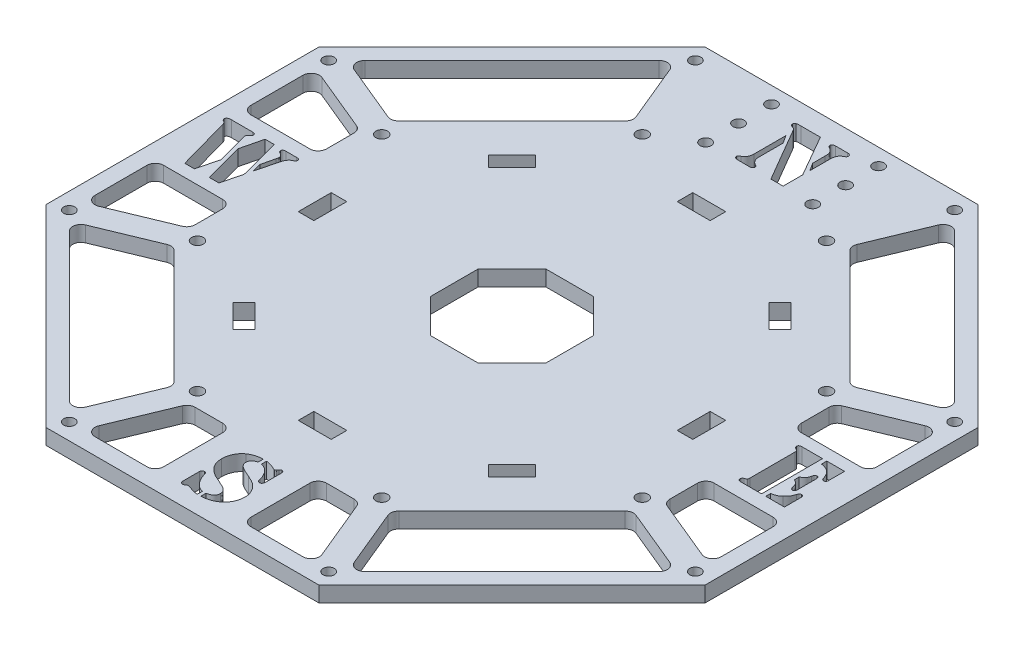
from build123d import *

# Parameters (mm, degrees)
BASE_DEPTH                   = 5.999988
SUPPORT_CUTOUTS_REACH        = 181.705
SKETCH4_W                    = 12.7
SKETCH4_H                    = 5.999988
SUPPORT_CUTOUT_PATTERN_COUNT = 8
F_8_CLEARANCE_HOLE1_D        = 4.4958
MOTOR_WIRE_HOLES_DEPTH       = 180.705313934
MOUNT_CLEARANCE_HOLES_D      = 4.3053
MOUNT_CLEARANCE_HOLES_DEPTH  = 6.35
F_8_CLEARANCE_HOLE2_D        = 4.3053
LIGHTENNING_1_DEPTH          = 180.705313934
DIRECTIONS_DEPTH             = 180.705313934
LIGHTENNING_2_DEPTH          = 180.705314078
LIGHTENNING_2_CIRC_PAT_COUNT = 3
LIGHTENNING_2_CIRC_PAT_ANGLE = 180


with BuildPart() as part:
    # Base sketch → Base (new body)
    with BuildSketch(Plane(origin=(0, 0, 0), x_dir=(1, 0, 0), z_dir=(0, 1, 0))):
        Polygon((-127, 52.605122421), (-127, -52.605122421), (-52.605122421, -127), (52.605122421, -127), (127, -52.605122421), (127, 52.605122421), (52.605122421, 127), (-52.605122421, 127), align=None)
    extrude(amount=BASE_DEPTH)

    # Sketch4 → Support cutouts (cut, up to next)
    with BuildSketch(Plane(origin=(0, 5.999988, 0), x_dir=(1, 0, 0), z_dir=(0, 1, 0)), mode=Mode.PRIVATE) as support_cutouts_sk1:
        with Locations((0, 73.025)):
            Rectangle(SKETCH4_W, SKETCH4_H)
    support_cutouts_tool1 = extrude(support_cutouts_sk1.sketch, amount=-SUPPORT_CUTOUTS_REACH, mode=Mode.PRIVATE) & part.part
    support_cutouts = support_cutouts_tool1.solids().sort_by_distance((0, 5.999988, -73.025))[0]
    add(support_cutouts, mode=Mode.SUBTRACT)

    # Support cutout pattern: Support cutouts ×8 about axis
    support_cutout_pattern_axis = Axis((0, -0.29972, 0), (0, 1, 0))
    for i in range(1, SUPPORT_CUTOUT_PATTERN_COUNT):
        add(support_cutouts.rotate(support_cutout_pattern_axis, i * 360 / SUPPORT_CUTOUT_PATTERN_COUNT), mode=Mode.SUBTRACT)

    # #8 Clearance Hole1 (through all)
    with Locations(Plane(origin=(0, 5.999988, 0), x_dir=(1, 0, 0), z_dir=(0, 1, 0))):
        with Locations((-85.725, 35.508457634), (-35.508457634, 85.725), (35.508457634, 85.725), (85.725, 35.508457634), (85.725, -35.508457634), (35.508457634, -85.725), (-35.508457634, -85.725), (-85.725, -35.508457634)):
            Hole(F_8_CLEARANCE_HOLE1_D / 2)

    # Sketch29 → Motor wire holes (cut, through all)
    with BuildSketch(Plane(origin=(0, 5.999988, 0), x_dir=(1, 0, 0), z_dir=(0, 1, 0))):
        Polygon((-22.225, -9.205896424), (-9.205896424, -22.225), (9.205896424, -22.225), (22.225, -9.205896424), (22.225, 9.205896424), (9.205896424, 22.225), (-9.205896424, 22.225), (-22.225, 9.205896424), align=None)
    extrude(amount=-MOTOR_WIRE_HOLES_DEPTH, mode=Mode.SUBTRACT)

    # mount clearance holes
    with Locations(Plane(origin=(0, 5.999988, 0), x_dir=(1, 0, 0), z_dir=(0, 1, 0))):
        with Locations((-120.65, 49.9748663), (-49.9748663, 120.65), (49.9748663, 120.65), (120.65, 49.9748663), (120.65, -49.9748663), (49.9748663, -120.65), (-49.9748663, -120.65), (-120.65, -49.9748663)):
            Hole(MOUNT_CLEARANCE_HOLES_D / 2, depth=MOUNT_CLEARANCE_HOLES_DEPTH)

    # #8 Clearance Hole2 (through all)
    with Locations(Plane(origin=(0, 5.999988, 0), x_dir=(1, 0, 0), z_dir=(0, 1, 0))):
        with Locations((20.6375, 95.25), (20.6375, 107.95), (20.6375, 120.65), (-20.6375, 120.65), (-20.6375, 107.95), (-20.6375, 95.25)):
            Hole(F_8_CLEARANCE_HOLE2_D / 2)

    # Sketch36 → Lightenning 1 (cut, through all)
    with BuildSketch(Plane(origin=(0, 5.999988, 0), x_dir=(1, 0, 0), z_dir=(0, 1, 0))):
        with BuildLine():
            Line((-112.614920409, 51.801520213), (-90.389920409, 42.595623789))
            ThreePointArc((-90.389920409, 42.595623789), (-88.555488739, 42.41494804), (-86.929836481, 43.283877275))
            Line((-86.929836481, 43.283877275), (-43.283877275, 86.929836481))
            ThreePointArc((-43.283877275, 86.929836481), (-42.41494804, 88.555488739), (-42.595623789, 90.389920409))
            Line((-42.595623789, 90.389920409), (-51.801520213, 112.614920409))
            ThreePointArc((-51.801520213, 112.614920409), (-54.115425956, 114.513893776), (-56.979901759, 113.644964541))
            Line((-56.979901759, 113.644964541), (-113.644964541, 56.979901759))
            ThreePointArc((-113.644964541, 56.979901759), (-114.513893776, 54.115425956), (-112.614920409, 51.801520213))
        make_face()
        with BuildLine():
            Line((56.979901759, 113.644964541), (113.644964541, 56.979901759))
            ThreePointArc((113.644964541, 56.979901759), (114.513893776, 54.115425956), (112.614920409, 51.801520213))
            Line((112.614920409, 51.801520213), (90.389920409, 42.595623789))
            ThreePointArc((90.389920409, 42.595623789), (88.555488739, 42.41494804), (86.929836481, 43.283877275))
            Line((86.929836481, 43.283877275), (43.283877275, 86.929836481))
            ThreePointArc((43.283877275, 86.929836481), (42.41494804, 88.555488739), (42.595623789, 90.389920409))
            Line((42.595623789, 90.389920409), (51.801520213, 112.614920409))
            ThreePointArc((51.801520213, 112.614920409), (54.115425956, 114.513893776), (56.979901759, 113.644964541))
        make_face()
        with BuildLine():
            Line((113.644964541, -56.979901759), (56.979901759, -113.644964541))
            ThreePointArc((56.979901759, -113.644964541), (54.115425956, -114.513893776), (51.801520213, -112.614920409))
            Line((51.801520213, -112.614920409), (42.595623789, -90.389920409))
            ThreePointArc((42.595623789, -90.389920409), (42.41494804, -88.555488739), (43.283877275, -86.929836481))
            Line((43.283877275, -86.929836481), (86.929836481, -43.283877275))
            ThreePointArc((86.929836481, -43.283877275), (88.555488739, -42.41494804), (90.389920409, -42.595623789))
            Line((90.389920409, -42.595623789), (112.614920409, -51.801520213))
            ThreePointArc((112.614920409, -51.801520213), (114.513893776, -54.115425956), (113.644964541, -56.979901759))
        make_face()
        with BuildLine():
            Line((-56.979901759, -113.644964541), (-113.644964541, -56.979901759))
            ThreePointArc((-113.644964541, -56.979901759), (-114.513893776, -54.115425956), (-112.614920409, -51.801520213))
            Line((-112.614920409, -51.801520213), (-90.389920409, -42.595623789))
            ThreePointArc((-90.389920409, -42.595623789), (-88.555488739, -42.41494804), (-86.929836481, -43.283877275))
            Line((-86.929836481, -43.283877275), (-43.283877275, -86.929836481))
            ThreePointArc((-43.283877275, -86.929836481), (-42.41494804, -88.555488739), (-42.595623789, -90.389920409))
            Line((-42.595623789, -90.389920409), (-51.801520213, -112.614920409))
            ThreePointArc((-51.801520213, -112.614920409), (-54.115425956, -114.513893776), (-56.979901759, -113.644964541))
        make_face()
    extrude(amount=-LIGHTENNING_1_DEPTH, mode=Mode.SUBTRACT)

    # Sketch37 → Directions (cut, through all)
    with BuildSketch(Plane(origin=(0, 5.999988, 0), x_dir=(1, 0, 0), z_dir=(0, 1, 0))):
        with BuildLine():
            Line((-0.263655027, 119.115560665), (8.895510373, 103.159733252))
            Line((8.895510373, 103.159733252), (8.895510373, 95.602783972))
            Line((8.895510373, 95.602783972), (4.196016594, 95.602783972))
            Line((4.196016594, 95.602783972), (-7.565474351, 115.758050452))
            add(Edge.make_bspline(
                [(-7.565474351, 115.758050452), (-7.626545799, 115.858484028), (-7.740071239, 116.045179551), (-7.898822848, 116.301319094), (-8.049204258, 116.502903942), (-8.222803652, 116.707787914), (-8.466187591, 116.913139143), (-8.696438169, 117.002669141), (-8.815611133, 117.049008026)],
                knots=[0, 0, 0, 0, 1.148206832, 2.134396517, 2.941784819, 3.601293645, 4.758478929, 6, 6, 6, 6], degree=3))
            Line((-8.815611133, 117.049008026), (-9.473846418, 117.288830184))
            add(Edge.make_bspline(
                [(-9.473846418, 117.288830184), (-9.55527066, 117.324691169), (-9.717709786, 117.396232848), (-9.904505623, 117.592550574), (-10.019149579, 117.836024562), (-10.036623424, 118.012257311), (-10.045337518, 118.100143443)],
                knots=[0, 0, 0, 0, 1.002473422, 1.999906911, 3.00256651, 4, 4, 4, 4], degree=3))
            add(Edge.make_bspline(
                [(-10.045337518, 118.100143443), (-10.037149376, 118.195015854), (-10.020718931, 118.385388219), (-9.897734175, 118.647272373), (-9.71184523, 118.871275333), (-9.539105479, 118.952710769), (-9.453436021, 118.993098287)],
                knots=[0, 0, 0, 0, 0.998849935, 2.004306838, 3.010245474, 4, 4, 4, 4], degree=3))
            add(Edge.make_bspline(
                [(-9.453436021, 118.993098287), (-9.382409116, 119.013998559), (-9.199550463, 119.067806278), (-8.849403273, 119.086590792), (-8.374085078, 119.118367463), (-8.012973394, 119.116569356), (-7.810399108, 119.115560665)],
                knots=[0, 0, 0, 0, 0.536148819, 1.380314255, 2.53042427, 4, 4, 4, 4], degree=3))
            Line((-7.810399108, 119.115560665), (-0.263655027, 119.115560665))
        make_face()
        with BuildLine():
            Line((-7.432806774, 112.977133937), (-5.473408717, 109.961497864))
            Line((-5.473408717, 109.961497864), (-5.473408717, 100.776819469))
            add(Edge.make_bspline(
                [(-5.473408717, 100.776819469), (-5.469055935, 100.586021928), (-5.460700363, 100.21976823), (-5.382728119, 99.6981249), (-5.262710119, 99.227406629), (-5.089068936, 98.805729823), (-4.85213913, 98.431592131), (-4.564343169, 98.090725132), (-4.214003136, 97.787147282), (-3.946837055, 97.621522578), (-3.809961407, 97.536669035)],
                knots=[0, 0, 0, 0, 1.190721145, 2.285700438, 3.285246989, 4.21825195, 5.120024924, 6.039327733, 6.995500152, 8, 8, 8, 8], degree=3))
            Line((-3.809961407, 97.536669035), (-3.299701496, 97.245820885))
            add(Edge.make_bspline(
                [(-3.299701496, 97.245820885), (-3.231857884, 97.201860435), (-3.100479182, 97.116731315), (-2.959354433, 96.929548908), (-2.872470899, 96.712152954), (-2.86483304, 96.556123983), (-2.860877973, 96.47532842)],
                knots=[0, 0, 0, 0, 1.033525086, 2.00141443, 2.965084209, 4, 4, 4, 4], degree=3))
            add(Edge.make_bspline(
                [(-2.860877973, 96.47532842), (-2.864956803, 96.411995733), (-2.872848076, 96.28946659), (-2.93060722, 96.112330477), (-3.036684603, 95.957436924), (-3.129500678, 95.871499071), (-3.177239118, 95.827298333)],
                knots=[0, 0, 0, 0, 1.017932389, 1.969384057, 2.955585702, 4, 4, 4, 4], degree=3))
            add(Edge.make_bspline(
                [(-3.177239118, 95.827298333), (-3.232072148, 95.792158738), (-3.358904473, 95.710878595), (-3.60964788, 95.649789644), (-3.924156844, 95.610370207), (-4.156704558, 95.605474468), (-4.284503124, 95.602783972)],
                knots=[0, 0, 0, 0, 0.677978509, 1.568207904, 2.663588058, 4, 4, 4, 4], degree=3))
            Line((-4.284503124, 95.602783972), (-8.397198006, 95.602783972))
            add(Edge.make_bspline(
                [(-8.397198006, 95.602783972), (-8.526583167, 95.6057372), (-8.7673749, 95.611233293), (-9.104615381, 95.650410986), (-9.390388373, 95.718713479), (-9.626206962, 95.817067881), (-9.817639262, 95.936422178), (-9.951644061, 96.097510927), (-10.032074991, 96.288123463), (-10.040832926, 96.425222666), (-10.045337518, 96.495738816)],
                knots=[0, 0, 0, 0, 1.481402756, 2.756958638, 3.881237287, 4.832623133, 5.67532584, 6.435925958, 7.195527913, 8, 8, 8, 8], degree=3))
            add(Edge.make_bspline(
                [(-10.045337518, 96.495738816), (-10.040152027, 96.59001324), (-10.030404998, 96.767218379), (-9.903412197, 96.961501544), (-9.760252857, 97.097334013), (-9.59197636, 97.203111948), (-9.385634761, 97.33974442), (-9.224767325, 97.424262529), (-9.137074877, 97.470335246)],
                knots=[0, 0, 0, 0, 1.181703852, 2.22121744, 2.84898449, 3.689607338, 4.740553118, 6, 6, 6, 6], degree=3))
            add(Edge.make_bspline(
                [(-9.137074877, 97.470335246), (-9.001741347, 97.549749907), (-8.735097603, 97.706218319), (-8.383480555, 98.008009414), (-8.08712602, 98.356551203), (-7.8415043, 98.750980375), (-7.66103498, 99.1938922), (-7.527667687, 99.680178882), (-7.444771772, 100.212710799), (-7.436890013, 100.584308772), (-7.432806774, 100.776819469)],
                knots=[0, 0, 0, 0, 0.957876818, 1.887277031, 2.816677243, 3.745902915, 4.715393506, 5.729584291, 6.823784461, 8, 8, 8, 8], degree=3))
            Line((-7.432806774, 100.776819469), (-7.432806774, 112.977133937))
        make_face()
        with BuildLine():
            Line((8.895510373, 105.899828974), (6.936112316, 108.971593637))
            Line((6.936112316, 108.971593637), (6.936112316, 113.727216006))
            add(Edge.make_bspline(
                [(6.936112316, 113.727216006), (6.932370616, 113.958808382), (6.925354947, 114.393043082), (6.844437365, 115.002740085), (6.71114161, 115.525534451), (6.518028543, 115.977300644), (6.246621586, 116.364743581), (5.901854431, 116.717183716), (5.473651649, 117.039234765), (5.147590907, 117.219744535), (4.976714258, 117.31434318)],
                knots=[0, 0, 0, 0, 1.271815313, 2.384648193, 3.370695924, 4.228477648, 5.068356943, 5.953941433, 6.927734667, 8, 8, 8, 8], degree=3))
            add(Edge.make_bspline(
                [(4.976714258, 117.31434318), (4.868164473, 117.368374875), (4.676595176, 117.463730326), (4.449027176, 117.669039397), (4.342163456, 117.929734698), (4.330013976, 118.11121522), (4.323581572, 118.207298024)],
                knots=[0, 0, 0, 0, 1.226241823, 2.164078746, 3.027992319, 4, 4, 4, 4], degree=3))
            add(Edge.make_bspline(
                [(4.323581572, 118.207298024), (4.326975856, 118.280925883), (4.333427371, 118.420870337), (4.39560321, 118.613739811), (4.497218709, 118.775411138), (4.640205843, 118.907587108), (4.83086028, 119.004147112), (5.066805997, 119.067762156), (5.347898121, 119.107207651), (5.551458827, 119.112647635), (5.660462539, 119.115560665)],
                knots=[0, 0, 0, 0, 0.955472393, 1.816066146, 2.601729087, 3.415848399, 4.316465065, 5.352792599, 6.582460055, 8, 8, 8, 8], degree=3))
            Line((5.660462539, 119.115560665), (10.099723763, 119.115560665))
            add(Edge.make_bspline(
                [(10.099723763, 119.115560665), (10.231200093, 119.114693389), (10.470112236, 119.113117417), (10.789021961, 119.053755456), (11.046686526, 118.979509893), (11.168227766, 118.879435816), (11.222295567, 118.834917714)],
                knots=[0, 0, 0, 0, 1.33001182, 2.416830264, 3.295724593, 4, 4, 4, 4], degree=3))
            add(Edge.make_bspline(
                [(11.222295567, 118.834917714), (11.267367314, 118.787447308), (11.354058135, 118.696142915), (11.440780073, 118.529960918), (11.502163208, 118.356235674), (11.506074744, 118.233353879), (11.508041117, 118.17157983)],
                knots=[0, 0, 0, 0, 1.052575171, 2.024518947, 3.006903635, 4, 4, 4, 4], degree=3))
            add(Edge.make_bspline(
                [(11.508041117, 118.17157983), (11.503088142, 118.062665223), (11.494157556, 117.866284027), (11.377184755, 117.641680356), (11.227345989, 117.504126386), (11.056090138, 117.394165041), (10.837562827, 117.256760671), (10.666903244, 117.168405525), (10.57426548, 117.120444414)],
                knots=[0, 0, 0, 0, 1.290521724, 2.326907359, 2.91622468, 3.705360723, 4.754419484, 6, 6, 6, 6], degree=3))
            add(Edge.make_bspline(
                [(10.57426548, 117.120444414), (10.429053095, 117.037536479), (10.141124735, 116.873145918), (9.778542642, 116.526520488), (9.451861706, 116.135342779), (9.296322712, 115.828064847), (9.216974117, 115.671306267)],
                knots=[0, 0, 0, 0, 0.989285188, 1.961563128, 2.960086498, 4, 4, 4, 4], degree=3))
            add(Edge.make_bspline(
                [(9.216974117, 115.671306267), (9.16528334, 115.541568359), (9.05617796, 115.267726402), (8.969221397, 114.806746706), (8.904508661, 114.288690613), (8.898622194, 113.921387183), (8.895510373, 113.727216006)],
                knots=[0, 0, 0, 0, 0.843106883, 1.779572689, 2.826193964, 4, 4, 4, 4], degree=3))
            Line((8.895510373, 113.727216006), (8.895510373, 105.899828974))
        make_face()
        with BuildLine():
            Line((-0.165809003, -95.676400154), (-0.165809003, -97.676619004))
            add(Edge.make_bspline(
                [(-0.165809003, -97.676619004), (-0.342705037, -97.726235639), (-0.681805932, -97.821348259), (-1.142650012, -98.03451557), (-1.543202451, -98.277899915), (-1.873082632, -98.565569819), (-2.138002456, -98.890793734), (-2.313752552, -99.261205607), (-2.434916003, -99.660783521), (-2.446059136, -99.941230731), (-2.451773404, -100.085045784)],
                knots=[0, 0, 0, 0, 1.221315998, 2.341201987, 3.368653272, 4.331620241, 5.242373549, 6.138723041, 7.045525736, 8, 8, 8, 8], degree=3))
            add(Edge.make_bspline(
                [(-2.451773404, -100.085045784), (-2.445869196, -100.224988106), (-2.434372518, -100.497483908), (-2.344659545, -100.894135591), (-2.196307543, -101.262634831), (-1.987397074, -101.608450039), (-1.706737131, -101.930288608), (-1.356833038, -102.241583461), (-0.929569207, -102.541217947), (-0.612984525, -102.723928136), (-0.446451954, -102.820038906)],
                knots=[0, 0, 0, 0, 0.936089583, 1.822754381, 2.706490469, 3.585151587, 4.513803219, 5.553860443, 6.713260834, 8, 8, 8, 8], degree=3))
            add(Edge.make_bspline(
                [(-0.446451954, -102.820038906), (-0.376996981, -102.858000582), (-0.219421744, -102.944125733), (0.050894288, -103.073928874), (0.379479024, -103.22801943), (0.765379102, -103.403368433), (1.203780046, -103.612495034), (1.705847192, -103.827084946), (2.262552468, -104.074650787), (2.654118808, -104.245608896), (2.860032268, -104.335510841)],
                knots=[0, 0, 0, 0, 0.522083255, 1.184470872, 1.977560059, 2.916398476, 3.980628574, 5.181427924, 6.517794128, 8, 8, 8, 8], degree=3))
            add(Edge.make_bspline(
                [(2.860032268, -104.335510841), (3.10734466, -104.442848861), (3.575905103, -104.64621251), (4.229405861, -104.957547811), (4.796540752, -105.250292093), (5.435509407, -105.626661316), (6.161643774, -106.146739124), (6.664460458, -106.643085234), (6.921701159, -106.897015594)],
                knots=[0, 0, 0, 0, 1.002664352, 1.899657555, 2.691938798, 3.375452079, 4.657282928, 6, 6, 6, 6], degree=3))
            add(Edge.make_bspline(
                [(6.921701159, -106.897015594), (7.085130862, -107.076061186), (7.407840771, -107.429606382), (7.825372823, -108.005734447), (8.187472032, -108.601818532), (8.472629673, -109.230448218), (8.697633412, -109.879730921), (8.863039803, -110.553926923), (8.962009758, -111.255069027), (8.972654046, -111.732260028), (8.9780486, -111.974101707)],
                knots=[0, 0, 0, 0, 1.034400775, 2.042537998, 3.032752643, 4.007694519, 4.983852961, 5.96324819, 6.967768718, 8, 8, 8, 8], degree=3))
            add(Edge.make_bspline(
                [(8.9780486, -111.974101707), (8.964578358, -112.337477438), (8.938039256, -113.053401168), (8.71889728, -114.101934123), (8.373813733, -115.105303795), (7.879366934, -116.048248439), (7.270634211, -116.919911591), (6.546962761, -117.697820759), (5.722531129, -118.381663053), (5.102339157, -118.741788291), (4.788814731, -118.923841693)],
                knots=[0, 0, 0, 0, 1.021726653, 2.013008284, 3.001500974, 3.999129692, 4.999052287, 5.98466679, 6.981192572, 8, 8, 8, 8], degree=3))
            add(Edge.make_bspline(
                [(4.788814731, -118.923841693), (4.611264477, -119.012830555), (4.250956564, -119.193418252), (3.685985162, -119.424841418), (3.097004586, -119.630627177), (2.491691596, -119.800754087), (1.885571133, -119.938917476), (1.292257471, -120.034188773), (0.720135172, -120.100604018), (0.344626645, -120.108755754), (0.16075734, -120.112747285)],
                knots=[0, 0, 0, 0, 0.988584579, 2.006163536, 3.03732575, 4.093604654, 5.135285673, 6.130774793, 7.084726137, 8, 8, 8, 8], degree=3))
            Line((0.16075734, -120.112747285), (0.16075734, -118.158451826))
            add(Edge.make_bspline(
                [(0.16075734, -118.158451826), (0.403804689, -118.097084484), (0.860505192, -117.981771579), (1.480511441, -117.745451506), (2.000998006, -117.486785204), (2.412932071, -117.174576629), (2.727031599, -116.812005698), (2.94395881, -116.390505535), (3.08141839, -115.915026204), (3.093571737, -115.577521706), (3.099854426, -115.403048308)],
                knots=[0, 0, 0, 0, 1.35896739, 2.553580996, 3.593739597, 4.501887768, 5.339697937, 6.17353428, 7.055806124, 8, 8, 8, 8], degree=3))
            add(Edge.make_bspline(
                [(3.099854426, -115.403048308), (3.087050338, -115.214179856), (3.061555371, -114.838112881), (2.854111285, -114.297436242), (2.518336932, -113.794434416), (2.213641511, -113.514134926), (2.053821609, -113.367111263)],
                knots=[0, 0, 0, 0, 0.956506711, 1.904556217, 2.900890541, 4, 4, 4, 4], degree=3))
            add(Edge.make_bspline(
                [(2.053821609, -113.367111263), (1.989815767, -113.316930764), (1.853393106, -113.209975568), (1.619111461, -113.055967004), (1.344791046, -112.896014624), (1.034688212, -112.72184186), (0.683788864, -112.542076343), (0.292695955, -112.356456246), (-0.135739283, -112.154833794), (-0.437512811, -112.025858016), (-0.594427328, -111.958793909)],
                knots=[0, 0, 0, 0, 0.648896759, 1.383064736, 2.23514521, 3.183146396, 4.221327961, 5.380997987, 6.638185931, 8, 8, 8, 8], degree=3))
            add(Edge.make_bspline(
                [(-0.594427328, -111.958793909), (-0.766490903, -111.884580254), (-1.095865551, -111.742515924), (-1.565658652, -111.528120009), (-2.000590258, -111.346254266), (-2.384739266, -111.160878661), (-2.735391976, -111.014506176), (-3.035495935, -110.865590472), (-3.300322229, -110.747577504), (-3.726734725, -110.538228832), (-4.31980512, -110.209725292), (-4.808548329, -109.869350833), (-5.054098949, -109.698342504)],
                knots=[0, 0, 0, 0, 1.121856981, 2.147527434, 3.091543735, 3.943587412, 4.700435388, 5.36546554, 5.948667186, 6.435970719, 8.209387708, 10, 10, 10, 10], degree=3))
            add(Edge.make_bspline(
                [(-5.054098949, -109.698342504), (-5.313642587, -109.502975742), (-5.821312905, -109.120836123), (-6.492460938, -108.469705339), (-7.061806953, -107.770311688), (-7.523922307, -107.017792018), (-7.889559999, -106.220216668), (-8.144906399, -105.372153301), (-8.302422921, -104.477465218), (-8.320656258, -103.863332905), (-8.329967577, -103.549710578)],
                knots=[0, 0, 0, 0, 1.072629812, 2.098076158, 3.081155049, 4.045090279, 5.008386299, 5.971993782, 6.964346906, 8, 8, 8, 8], degree=3))
            add(Edge.make_bspline(
                [(-8.329967577, -103.549710578), (-8.320545622, -103.227608935), (-8.3019902, -102.59326797), (-8.143271935, -101.661846922), (-7.888161215, -100.767743433), (-7.531353155, -99.918595728), (-7.085944775, -99.124793509), (-6.542516403, -98.413987434), (-5.932801219, -97.768638102), (-5.459480123, -97.418309982), (-5.22248472, -97.24289808)],
                knots=[0, 0, 0, 0, 1.056681967, 2.081009744, 3.091782246, 4.102755181, 5.097879215, 6.070461086, 7.033865475, 8, 8, 8, 8], degree=3))
            add(Edge.make_bspline(
                [(-5.22248472, -97.24289808), (-5.048930425, -97.129632673), (-4.699433962, -96.901543478), (-4.141187358, -96.606645523), (-3.552805436, -96.350426484), (-2.932535948, -96.137636568), (-2.285383857, -95.958339564), (-1.606887438, -95.820624725), (-0.897837006, -95.722683024), (-0.412718479, -95.69201114), (-0.165809003, -95.676400154)],
                knots=[0, 0, 0, 0, 0.927145534, 1.867047348, 2.821631238, 3.796636345, 4.799446147, 5.825081488, 6.893037554, 8, 8, 8, 8], degree=3))
        make_face()
        with BuildLine():
            Line((1.140456369, -97.676619004), (1.140456369, -95.763144339))
            add(Edge.make_bspline(
                [(1.140456369, -95.763144339), (1.305629221, -95.776682379), (1.624983499, -95.802857571), (2.084918334, -95.869581803), (2.511202839, -95.955351541), (2.921124243, -96.06873347), (3.357047076, -96.212748233), (3.847678419, -96.416463475), (4.420799311, -96.664966056), (4.823522655, -96.858682825), (5.038842088, -96.962255129)],
                knots=[0, 0, 0, 0, 0.967485975, 1.870590603, 2.71201151, 3.504661189, 4.352621131, 5.390918259, 6.60503244, 8, 8, 8, 8], degree=3))
            add(Edge.make_bspline(
                [(5.038842088, -96.962255129), (5.140982418, -97.007407476), (5.320910505, -97.086946827), (5.515850277, -97.110327574), (5.60012799, -97.120435701)],
                knots=[0, 0, 0, 0, 1.13534614, 2, 2, 2, 2], degree=3))
            add(Edge.make_bspline(
                [(5.60012799, -97.120435701), (5.649954386, -97.118072845), (5.747388884, -97.113452328), (5.881529774, -97.060708345), (5.996818026, -96.975374852), (6.048036273, -96.896246965), (6.074669707, -96.855100548)],
                knots=[0, 0, 0, 0, 1.041120632, 2.035890107, 2.978664937, 4, 4, 4, 4], degree=3))
            Line((6.074669707, -96.855100548), (6.452262041, -96.263199051))
            add(Edge.make_bspline(
                [(6.452262041, -96.263199051), (6.496625328, -96.194059045), (6.578975318, -96.065716914), (6.744538207, -95.924013338), (6.92207064, -95.826188292), (7.051477641, -95.818152255), (7.115599925, -95.81417033)],
                knots=[0, 0, 0, 0, 1.167643081, 2.167454281, 3.0919578, 4, 4, 4, 4], degree=3))
            add(Edge.make_bspline(
                [(7.115599925, -95.81417033), (7.187618553, -95.817177711), (7.324973347, -95.822913426), (7.514266689, -95.891058418), (7.670764126, -96.004825432), (7.796116001, -96.163260778), (7.884974112, -96.371499399), (7.958493439, -96.620900575), (7.987723116, -96.924241436), (7.994615593, -97.140855744), (7.998349571, -97.258205877)],
                knots=[0, 0, 0, 0, 0.897447072, 1.711621872, 2.473249793, 3.290475505, 4.204161629, 5.288175448, 6.530877421, 8, 8, 8, 8], degree=3))
            Line((7.998349571, -97.258205877), (7.998349571, -103.013937672))
            add(Edge.make_bspline(
                [(7.998349571, -103.013937672), (7.996688784, -103.104488389), (7.993487365, -103.279038717), (7.933134759, -103.525909931), (7.848439902, -103.750383437), (7.725153041, -103.942680241), (7.578694578, -104.10646903), (7.400469749, -104.217240353), (7.20553235, -104.297706454), (7.065438128, -104.302448134), (6.993137546, -104.304895246)],
                knots=[0, 0, 0, 0, 1.18556103, 2.285349829, 3.31800963, 4.321767828, 5.269816893, 6.174247696, 7.05775591, 8, 8, 8, 8], degree=3))
            add(Edge.make_bspline(
                [(6.993137546, -104.304895246), (6.881070938, -104.29507923), (6.651489418, -104.274969975), (6.462337989, -104.142887023), (6.365517856, -104.075278287)],
                knots=[0, 0, 0, 0, 0.976268549, 2, 2, 2, 2], degree=3))
            add(Edge.make_bspline(
                [(6.365517856, -104.075278287), (6.317665767, -104.024119962), (6.219707041, -103.91939299), (6.096139709, -103.710773903), (6.007049817, -103.411086554), (5.962999587, -103.177721201), (5.936899531, -103.039450667)],
                knots=[0, 0, 0, 0, 0.734618928, 1.503849384, 2.521014053, 4, 4, 4, 4], degree=3))
            add(Edge.make_bspline(
                [(5.936899531, -103.039450667), (5.862152732, -102.740564813), (5.707212188, -102.121012705), (5.301427801, -101.232737845), (4.828692028, -100.360826574), (4.421975489, -99.840353323), (4.22242623, -99.584991071)],
                knots=[0, 0, 0, 0, 0.948439242, 1.965993117, 3.002045587, 4, 4, 4, 4], degree=3))
            add(Edge.make_bspline(
                [(4.22242623, -99.584991071), (4.011997709, -99.355888702), (3.596942244, -98.904000386), (2.848289295, -98.367066762), (2.033146711, -97.935290656), (1.440311973, -97.763507078), (1.140456369, -97.676619004)],
                knots=[0, 0, 0, 0, 1.010958313, 1.994044201, 2.985388257, 4, 4, 4, 4], degree=3))
        make_face()
        with BuildLine():
            Line((-1.145508032, -118.158451826), (-1.145508032, -120.112747285))
            add(Edge.make_bspline(
                [(-1.145508032, -120.112747285), (-1.389314606, -120.10317083), (-1.890486765, -120.083485335), (-2.657175925, -119.940111743), (-3.460469148, -119.722712735), (-3.996153344, -119.515719651), (-4.273401286, -119.408588608)],
                knots=[0, 0, 0, 0, 0.90692939, 1.864296574, 2.894648409, 4, 4, 4, 4], degree=3))
            add(Edge.make_bspline(
                [(-4.273401286, -119.408588608), (-4.372084227, -119.369537561), (-4.55241572, -119.298176355), (-4.79635378, -119.200533857), (-4.991236393, -119.12642115), (-5.183409475, -119.067959567), (-5.386097315, -119.013207778), (-5.54356042, -119.004590544), (-5.62048745, -119.000380679)],
                knots=[0, 0, 0, 0, 1.349771181, 2.466548425, 3.342620573, 3.999496596, 5.022674002, 6, 6, 6, 6], degree=3))
            add(Edge.make_bspline(
                [(-5.62048745, -119.000380679), (-5.72128558, -119.000708661), (-5.896162767, -119.001277684), (-6.149760776, -119.066121723), (-6.405503893, -119.209765023), (-6.580110954, -119.339453828), (-6.686930664, -119.418793806)],
                knots=[0, 0, 0, 0, 1.025725037, 1.779555911, 2.641594495, 4, 4, 4, 4], degree=3))
            add(Edge.make_bspline(
                [(-6.686930664, -119.418793806), (-6.790848061, -119.485966217), (-6.996427968, -119.618853476), (-7.240015744, -119.64204486), (-7.360473746, -119.653513365)],
                knots=[0, 0, 0, 0, 1.010968418, 2, 2, 2, 2], degree=3))
            add(Edge.make_bspline(
                [(-7.360473746, -119.653513365), (-7.437452723, -119.649847343), (-7.581839136, -119.642971132), (-7.784378508, -119.585011016), (-7.958056813, -119.488775615), (-8.09272912, -119.342520359), (-8.201888076, -119.166477921), (-8.277730071, -118.950960907), (-8.322751993, -118.697808719), (-8.327455905, -118.515844735), (-8.329967577, -118.418684381)],
                knots=[0, 0, 0, 0, 1.030217647, 1.932338358, 2.800681709, 3.655444571, 4.566741571, 5.56230499, 6.698383569, 8, 8, 8, 8], degree=3))
            Line((-8.329967577, -118.418684381), (-8.329967577, -112.178205671))
            add(Edge.make_bspline(
                [(-8.329967577, -112.178205671), (-8.3280666, -112.111350776), (-8.32428966, -111.978520694), (-8.262922329, -111.792091278), (-8.182642467, -111.615161342), (-8.058368506, -111.464963689), (-7.911012751, -111.338639206), (-7.746168201, -111.236075515), (-7.557467615, -111.181744064), (-7.427084896, -111.169198066), (-7.360473746, -111.162788448)],
                knots=[0, 0, 0, 0, 1.025048767, 2.036609463, 2.997690381, 4.004487562, 5.007868388, 5.983135769, 6.96960544, 8, 8, 8, 8], degree=3))
            add(Edge.make_bspline(
                [(-7.360473746, -111.162788448), (-7.245372002, -111.167321716), (-7.027692041, -111.175895013), (-6.790879891, -111.333023835), (-6.650544016, -111.510528177), (-6.556202024, -111.691660095), (-6.469698546, -111.914638481), (-6.421913782, -112.079097809), (-6.396082515, -112.168000473)],
                knots=[0, 0, 0, 0, 1.332817487, 2.520619119, 3.18935181, 3.986203612, 4.911391244, 6, 6, 6, 6], degree=3))
            add(Edge.make_bspline(
                [(-6.396082515, -112.168000473), (-6.326223918, -112.405491782), (-6.186905498, -112.879118727), (-5.92016086, -113.568036632), (-5.605955558, -114.232485411), (-5.259188203, -114.873547746), (-4.865686641, -115.47395522), (-4.441251901, -116.031483739), (-3.989831694, -116.546088418), (-3.657153463, -116.849954459), (-3.492703622, -117.000161829)],
                knots=[0, 0, 0, 0, 1.039224005, 2.072515798, 3.098176232, 4.124234497, 5.130614068, 6.109159237, 7.065317673, 8, 8, 8, 8], degree=3))
            add(Edge.make_bspline(
                [(-3.492703622, -117.000161829), (-3.321424463, -117.143390775), (-2.980878047, -117.428166253), (-2.404771932, -117.75579372), (-1.792725309, -118.009668724), (-1.363365759, -118.108370425), (-1.145508032, -118.158451826)],
                knots=[0, 0, 0, 0, 1.009633933, 2.007408369, 2.988955799, 4, 4, 4, 4], degree=3))
        make_face()
        with BuildLine():
            Line((107.444627345, 12.245606487), (107.444627345, -11.267170205))
            Line((107.444627345, -11.267170205), (99.91829366, -11.267170205))
            Line((99.91829366, -11.267170205), (99.469264938, -11.267170205))
            add(Edge.make_bspline(
                [(99.469264938, -11.267170205), (99.380630348, -11.264237394), (99.214219406, -11.258731056), (98.978565467, -11.217949445), (98.772760595, -11.149367753), (98.601651414, -11.045325462), (98.461442111, -10.916431013), (98.37243214, -10.75406898), (98.310948611, -10.572446643), (98.304293129, -10.442832555), (98.300769742, -10.374215361)],
                knots=[0, 0, 0, 0, 1.275809178, 2.395324508, 3.433364274, 4.378530456, 5.262016052, 6.140052186, 7.015350866, 8, 8, 8, 8], degree=3))
            add(Edge.make_bspline(
                [(98.300769742, -10.374215361), (98.307711752, -10.265781859), (98.320769422, -10.061822368), (98.443261593, -9.783531621), (98.657328733, -9.570967071), (98.841394014, -9.492226171), (98.938594631, -9.450644923)],
                knots=[0, 0, 0, 0, 1.074896783, 2.021841926, 2.955380476, 4, 4, 4, 4], degree=3))
            add(Edge.make_bspline(
                [(98.938594631, -9.450644923), (99.018649585, -9.422063931), (99.158507597, -9.372132221), (99.339560634, -9.303020445), (99.466577609, -9.258912406), (99.569488747, -9.219274176), (99.663140661, -9.144399091), (99.711762722, -9.066684291), (99.739702691, -9.022026598)],
                knots=[0, 0, 0, 0, 1.641128884, 2.867093284, 3.73955991, 4.239698614, 4.988468111, 6, 6, 6, 6], degree=3))
            add(Edge.make_bspline(
                [(99.739702691, -9.022026598), (99.77097297, -8.970367618), (99.838332998, -8.85908782), (99.894021861, -8.655874204), (99.930676266, -8.416236955), (99.932573427, -8.243230547), (99.933601457, -8.14948215)],
                knots=[0, 0, 0, 0, 0.795728394, 1.714096871, 2.761318972, 4, 4, 4, 4], degree=3))
            Line((99.933601457, -8.14948215), (99.933601457, 9.066687243))
            add(Edge.make_bspline(
                [(99.933601457, 9.066687243), (99.93235509, 9.162090055), (99.930029795, 9.340079037), (99.895506026, 9.585298987), (99.837101563, 9.792643824), (99.77085942, 9.906221349), (99.739702691, 9.959642087)],
                knots=[0, 0, 0, 0, 1.234380862, 2.302932019, 3.201790819, 4, 4, 4, 4], degree=3))
            add(Edge.make_bspline(
                [(99.739702691, 9.959642087), (99.711747842, 10.004260542), (99.663099885, 10.08190706), (99.569588322, 10.15715223), (99.465697399, 10.195916596), (99.341061364, 10.247987491), (99.158137439, 10.313875793), (99.018514837, 10.364427265), (98.938594631, 10.393363011)],
                knots=[0, 0, 0, 0, 1.009569614, 1.75688657, 2.256055053, 3.138468602, 4.362054748, 6, 6, 6, 6], degree=3))
            add(Edge.make_bspline(
                [(98.938594631, 10.393363011), (98.840839551, 10.434398999), (98.653456303, 10.513059429), (98.444681894, 10.737053718), (98.320494562, 11.019693241), (98.30761491, 11.227108543), (98.300769742, 11.337343846)],
                knots=[0, 0, 0, 0, 1.03007389, 1.974512116, 2.923511095, 4, 4, 4, 4], degree=3))
            add(Edge.make_bspline(
                [(98.300769742, 11.337343846), (98.30437558, 11.407611161), (98.311192768, 11.540458392), (98.371218007, 11.726123912), (98.461586913, 11.88963688), (98.601489104, 12.019027172), (98.773816411, 12.121496316), (98.977349465, 12.19804784), (99.214411777, 12.236640485), (99.380697201, 12.242490581), (99.469264938, 12.245606487)],
                knots=[0, 0, 0, 0, 1.002003185, 1.894384998, 2.766311233, 3.643649008, 4.582238159, 5.621343591, 6.733068665, 8, 8, 8, 8], degree=3))
            Line((99.469264938, 12.245606487), (99.91829366, 12.245606487))
            Line((99.91829366, 12.245606487), (107.444627345, 12.245606487))
        make_face()
        with BuildLine():
            Line((109.07745906, 12.245606487), (115.935352262, 12.245606487))
            Line((115.935352262, 12.245606487), (115.935352262, 6.056153769))
            add(Edge.make_bspline(
                [(115.935352262, 6.056153769), (115.93501717, 5.974182618), (115.934397551, 5.822609776), (115.889303067, 5.614269738), (115.833350205, 5.435760599), (115.738812275, 5.293732328), (115.615650251, 5.185439987), (115.462606166, 5.11639258), (115.283521105, 5.06726771), (115.153363518, 5.063290412), (115.083218211, 5.061146942)],
                knots=[0, 0, 0, 0, 1.297100046, 2.398467488, 3.37194797, 4.248080405, 5.071011418, 5.940462097, 6.890061477, 8, 8, 8, 8], degree=3))
            add(Edge.make_bspline(
                [(115.083218211, 5.061146942), (114.975639172, 5.067764874), (114.784726323, 5.079509245), (114.555347519, 5.174960775), (114.448171062, 5.323711588), (114.36429782, 5.464189313), (114.28555902, 5.646516998), (114.240132881, 5.783633489), (114.215776362, 5.857152403)],
                knots=[0, 0, 0, 0, 1.496408907, 2.655570162, 3.259085196, 3.998612629, 4.926899124, 6, 6, 6, 6], degree=3))
            add(Edge.make_bspline(
                [(114.215776362, 5.857152403), (114.102689553, 6.176667342), (113.885686621, 6.789786402), (113.448178477, 7.628146972), (112.931870515, 8.344795566), (112.333499426, 8.945879906), (111.651397448, 9.432966082), (110.874846328, 9.801397966), (110.010633833, 10.071314543), (109.395662192, 10.155766496), (109.07745906, 10.199464245)],
                knots=[0, 0, 0, 0, 1.130832012, 2.169960077, 3.145894403, 4.069657363, 4.990096479, 5.930045021, 6.928948727, 8, 8, 8, 8], degree=3))
            Line((109.07745906, 10.199464245), (109.07745906, 12.245606487))
        make_face()
        with BuildLine():
            Line((109.07745906, -0.352710712), (109.07745906, 1.632200341))
            add(Edge.make_bspline(
                [(109.07745906, 1.632200341), (109.228015269, 1.713866996), (109.515805148, 1.869973719), (109.912886302, 2.119057681), (110.236667594, 2.395563589), (110.513534266, 2.678853338), (110.731883749, 3.005007654), (110.921224992, 3.366586563), (111.07377218, 3.778873799), (111.146887684, 4.07212954), (111.184832492, 4.224320689)],
                knots=[0, 0, 0, 0, 1.180986571, 2.257469038, 3.222785507, 4.110265038, 4.978639913, 5.917385587, 6.919184056, 8, 8, 8, 8], degree=3))
            add(Edge.make_bspline(
                [(111.184832492, 4.224320689), (111.206679239, 4.326890712), (111.246803598, 4.515273745), (111.330079845, 4.769405327), (111.416983415, 4.974571531), (111.523516771, 5.133734241), (111.650356742, 5.249252198), (111.795800191, 5.333894222), (111.966212538, 5.380117801), (112.086017933, 5.385090065), (112.149223723, 5.387713285)],
                knots=[0, 0, 0, 0, 1.505392146, 2.764846178, 3.836585285, 4.697326174, 5.492824879, 6.280783141, 7.092991927, 8, 8, 8, 8], degree=3))
            add(Edge.make_bspline(
                [(112.149223723, 5.387713285), (112.231864402, 5.384457962), (112.388931156, 5.3782709), (112.60071502, 5.28693367), (112.771179722, 5.140704469), (112.841939095, 5.01134776), (112.878895396, 4.943787163)],
                knots=[0, 0, 0, 0, 1.085852217, 2.06376913, 2.988742716, 4, 4, 4, 4], degree=3))
            add(Edge.make_bspline(
                [(112.878895396, 4.943787163), (112.897656352, 4.893204972), (112.942849626, 4.77135752), (112.968763611, 4.542762015), (112.998201064, 4.245543731), (112.996950783, 4.022080617), (112.996255175, 3.897754346)],
                knots=[0, 0, 0, 0, 0.609895254, 1.469176849, 2.591947466, 4, 4, 4, 4], degree=3))
            Line((112.996255175, 3.897754346), (112.996255175, -2.628469914))
            add(Edge.make_bspline(
                [(112.996255175, -2.628469914), (112.994457747, -2.754364412), (112.991147883, -2.986192167), (112.964145463, -3.304661004), (112.910135045, -3.560367746), (112.836117683, -3.762288661), (112.723144278, -3.909233522), (112.575668191, -4.011773101), (112.391920624, -4.073277734), (112.256884861, -4.079431905), (112.184941917, -4.08271066)],
                knots=[0, 0, 0, 0, 1.58411055, 2.917051989, 4.012593196, 4.866950163, 5.598911493, 6.305405458, 7.097171608, 8, 8, 8, 8], degree=3))
            add(Edge.make_bspline(
                [(112.184941917, -4.08271066), (112.06809723, -4.072590794), (111.84507069, -4.053274566), (111.602882811, -3.886579258), (111.471763551, -3.693659398), (111.381909854, -3.50889877), (111.298617581, -3.285348066), (111.257863967, -3.120556665), (111.235858483, -3.031575244)],
                knots=[0, 0, 0, 0, 1.342036637, 2.56160375, 3.240040044, 4.033620071, 4.938225671, 6, 6, 6, 6], degree=3))
            add(Edge.make_bspline(
                [(111.235858483, -3.031575244), (111.188884657, -2.843225629), (111.099139443, -2.483376793), (110.90774895, -1.989463115), (110.697863985, -1.557805675), (110.443415217, -1.200206809), (110.157621296, -0.902940057), (109.837813436, -0.658286586), (109.47435608, -0.471233305), (109.211664881, -0.392787662), (109.07745906, -0.352710712)],
                knots=[0, 0, 0, 0, 1.278531199, 2.442680666, 3.485773606, 4.434753066, 5.322955403, 6.195374153, 7.078038041, 8, 8, 8, 8], degree=3))
        make_face()
        with BuildLine():
            Line((109.07745906, -11.267170205), (109.07745906, -9.369003337))
            add(Edge.make_bspline(
                [(109.07745906, -9.369003337), (109.256319479, -9.338206454), (109.600267525, -9.27898414), (110.090515527, -9.169592244), (110.530732, -9.034629452), (110.935584605, -8.888558318), (111.309297417, -8.69628348), (111.681211672, -8.476080267), (112.050567345, -8.211893251), (112.288326279, -8.011667914), (112.409456278, -7.909659992)],
                knots=[0, 0, 0, 0, 1.178424117, 2.266106011, 3.258322885, 4.167001624, 5.056005255, 5.982165939, 6.971982955, 8, 8, 8, 8], degree=3))
            add(Edge.make_bspline(
                [(112.409456278, -7.909659992), (112.639289495, -7.695173596), (113.07808951, -7.285673895), (113.528064726, -6.686648428), (113.824277093, -6.175937008), (114.032581118, -5.740810733), (114.242123057, -5.255192552), (114.365807891, -4.906730174), (114.430085525, -4.725638148)],
                knots=[0, 0, 0, 0, 1.478913818, 2.823557948, 3.509390326, 4.258413643, 5.094916917, 6, 6, 6, 6], degree=3))
            add(Edge.make_bspline(
                [(114.430085525, -4.725638148), (114.461341608, -4.638506179), (114.519071808, -4.477572831), (114.613981107, -4.260353876), (114.715615023, -4.090744914), (114.850964982, -3.92072245), (115.082371304, -3.779539298), (115.290223568, -3.764209613), (115.399579355, -3.756144317)],
                knots=[0, 0, 0, 0, 1.119865357, 2.068399023, 2.86239926, 3.505232302, 4.687446157, 6, 6, 6, 6], degree=3))
            add(Edge.make_bspline(
                [(115.399579355, -3.756144317), (115.474597964, -3.760591298), (115.614695441, -3.768896047), (115.810078492, -3.815490783), (115.965241582, -3.912066536), (116.085296736, -4.04808947), (116.164221455, -4.232034382), (116.225347356, -4.4601525), (116.258116508, -4.741753584), (116.26058574, -4.946686546), (116.261918605, -5.05730709)],
                knots=[0, 0, 0, 0, 0.999578033, 1.866714988, 2.638932701, 3.392362113, 4.242509345, 5.27434009, 6.528718957, 8, 8, 8, 8], degree=3))
            Line((116.261918605, -5.05730709), (116.261918605, -11.267170205))
            Line((116.261918605, -11.267170205), (109.07745906, -11.267170205))
        make_face()
        with BuildLine():
            Line((-108.233737002, -3.784233821), (-110.315597439, -12.081059972))
            Line((-110.315597439, -12.081059972), (-114.035392189, -12.081059972))
            Line((-114.035392189, -12.081059972), (-119.689072001, 8.160950692))
            add(Edge.make_bspline(
                [(-119.689072001, 8.160950692), (-119.720431728, 8.266713505), (-119.777946303, 8.460685324), (-119.8696621, 8.721285075), (-119.953396374, 8.928337026), (-120.069758077, 9.134501373), (-120.285360776, 9.340059127), (-120.499622119, 9.435183893), (-120.617745039, 9.487626461)],
                knots=[0, 0, 0, 0, 1.167972537, 2.142092775, 2.924919439, 3.530384174, 4.638493406, 6, 6, 6, 6], degree=3))
            add(Edge.make_bspline(
                [(-120.617745039, 9.487626461), (-120.723644568, 9.534277512), (-120.922708786, 9.621969641), (-121.149049303, 9.839470942), (-121.29882403, 10.100828655), (-121.314026866, 10.295188128), (-121.321903716, 10.395889102)],
                knots=[0, 0, 0, 0, 1.124497015, 2.113768801, 3.022711285, 4, 4, 4, 4], degree=3))
            add(Edge.make_bspline(
                [(-121.321903716, 10.395889102), (-121.315931589, 10.474931113), (-121.304245452, 10.62959892), (-121.214670021, 10.845629147), (-121.061832069, 11.027157746), (-120.852235333, 11.175020586), (-120.590630756, 11.287745464), (-120.284165892, 11.376191389), (-119.930449275, 11.425077792), (-119.679010804, 11.429422052), (-119.546199226, 11.431716721)],
                knots=[0, 0, 0, 0, 0.825895137, 1.616094889, 2.400254808, 3.279859759, 4.275897844, 5.369034482, 6.610305417, 8, 8, 8, 8], degree=3))
            Line((-119.546199226, 11.431716721), (-111.489195234, 11.431716721))
            add(Edge.make_bspline(
                [(-111.489195234, 11.431716721), (-111.383634491, 11.428140361), (-111.188844746, 11.421540955), (-110.924023298, 11.391202403), (-110.709804741, 11.328333483), (-110.600122827, 11.255557327), (-110.550316998, 11.222510158)],
                knots=[0, 0, 0, 0, 1.295967113, 2.391429781, 3.269558928, 4, 4, 4, 4], degree=3))
            add(Edge.make_bspline(
                [(-110.550316998, 11.222510158), (-110.500528104, 11.178626254), (-110.40174646, 11.091560168), (-110.291621817, 10.924387), (-110.229163518, 10.728414375), (-110.222246833, 10.590242709), (-110.218648055, 10.518351481)],
                knots=[0, 0, 0, 0, 0.983124202, 1.950527883, 2.933652084, 4, 4, 4, 4], degree=3))
            add(Edge.make_bspline(
                [(-110.218648055, 10.518351481), (-110.22525178, 10.432014233), (-110.238469583, 10.259204359), (-110.356560605, 10.017854919), (-110.535241869, 9.794338944), (-110.698044078, 9.680906206), (-110.785036557, 9.620294037)],
                knots=[0, 0, 0, 0, 0.930220893, 1.861900385, 2.857518059, 4, 4, 4, 4], degree=3))
            add(Edge.make_bspline(
                [(-110.785036557, 9.620294037), (-110.854855622, 9.572865186), (-110.984021518, 9.485121385), (-111.159783817, 9.362177517), (-111.289059105, 9.241722462), (-111.421765647, 9.097183382), (-111.510329536, 8.850876827), (-111.519656474, 8.644601205), (-111.524913427, 8.528337828)],
                knots=[0, 0, 0, 0, 1.084177455, 2.005737993, 2.747551633, 3.35153173, 4.507240648, 6, 6, 6, 6], degree=3))
            add(Edge.make_bspline(
                [(-111.524913427, 8.528337828), (-111.521457548, 8.46518388), (-111.51449599, 8.337965936), (-111.487488021, 8.213449216), (-111.473887436, 8.150745494)],
                knots=[0, 0, 0, 0, 0.992846558, 2, 2, 2, 2], degree=3))
            Line((-111.473887436, 8.150745494), (-108.233737002, -3.784233821))
        make_face()
        Polygon((-106.595802688, 11.431716721), (-103.049496308, 11.431716721), (-98.91639103, -4.284288534), (-100.880891687, -12.081059972), (-104.631302032, -12.081059972), (-108.64704753, 2.981812597), align=None)
        with BuildLine():
            Line((-98.263258344, -1.539090213), (-99.156213188, 1.93577978))
            Line((-99.156213188, 1.93577978), (-97.957102397, 7.074097082))
            add(Edge.make_bspline(
                [(-97.957102397, 7.074097082), (-97.933967034, 7.169123992), (-97.890386788, 7.348126843), (-97.844944648, 7.600324392), (-97.817466695, 7.818495582), (-97.811755268, 7.9516851), (-97.809127023, 8.012975318)],
                knots=[0, 0, 0, 0, 1.232054524, 2.320829669, 3.227291176, 4, 4, 4, 4], degree=3))
            add(Edge.make_bspline(
                [(-97.809127023, 8.012975318), (-97.810992011, 8.096718497), (-97.814653801, 8.261143167), (-97.875082305, 8.496046888), (-97.960128427, 8.714859226), (-98.08802375, 8.91430706), (-98.255870384, 9.100835386), (-98.468160903, 9.278966052), (-98.724912278, 9.452865728), (-98.917030637, 9.55576959), (-99.018443012, 9.610088839)],
                knots=[0, 0, 0, 0, 0.942297429, 1.85014404, 2.71985303, 3.582543836, 4.507079092, 5.541809685, 6.702409717, 8, 8, 8, 8], degree=3))
            add(Edge.make_bspline(
                [(-99.018443012, 9.610088839), (-99.141855856, 9.678529527), (-99.356788076, 9.797723838), (-99.616660706, 10.018265853), (-99.748389009, 10.290218156), (-99.761566513, 10.47958489), (-99.768525081, 10.57958267)],
                knots=[0, 0, 0, 0, 1.299833306, 2.263751888, 3.083149647, 4, 4, 4, 4], degree=3))
            add(Edge.make_bspline(
                [(-99.768525081, 10.57958267), (-99.76379875, 10.64943799), (-99.75478569, 10.782651282), (-99.709690424, 10.970449185), (-99.60948798, 11.120643556), (-99.478463749, 11.243207806), (-99.300863517, 11.329949291), (-99.084202028, 11.386646147), (-98.826226913, 11.43039342), (-98.639377415, 11.431253663), (-98.538798696, 11.431716721)],
                knots=[0, 0, 0, 0, 0.979988515, 1.868826844, 2.660689651, 3.468822888, 4.351912292, 5.391040777, 6.595630283, 8, 8, 8, 8], degree=3))
            Line((-98.538798696, 11.431716721), (-94.436309012, 11.431716721))
            add(Edge.make_bspline(
                [(-94.436309012, 11.431716721), (-94.334066121, 11.431099747), (-94.143902893, 11.429952228), (-93.885338266, 11.388666722), (-93.673796136, 11.330013604), (-93.50597863, 11.243041669), (-93.383625683, 11.117979803), (-93.29339535, 10.964784059), (-93.243610686, 10.776450294), (-93.239419114, 10.641095064), (-93.237198222, 10.569377472)],
                knots=[0, 0, 0, 0, 1.436264049, 2.671331013, 3.67044523, 4.516302147, 5.294490511, 6.098722087, 6.992613176, 8, 8, 8, 8], degree=3))
            add(Edge.make_bspline(
                [(-93.237198222, 10.569377472), (-93.242561532, 10.482713054), (-93.252867687, 10.316178419), (-93.378530118, 10.090647577), (-93.587425363, 9.905916168), (-93.764836577, 9.821145254), (-93.864817912, 9.773372011)],
                knots=[0, 0, 0, 0, 0.951918298, 1.829209366, 2.776635693, 4, 4, 4, 4], degree=3))
            add(Edge.make_bspline(
                [(-93.864817912, 9.773372011), (-93.985178915, 9.717967909), (-94.213761421, 9.61274771), (-94.517700113, 9.426480115), (-94.779382261, 9.246694595), (-94.920949105, 9.10853966), (-94.987389716, 9.043700338)],
                knots=[0, 0, 0, 0, 1.179578336, 2.240185507, 3.174078154, 4, 4, 4, 4], degree=3))
            add(Edge.make_bspline(
                [(-94.987389716, 9.043700338), (-95.114893835, 8.899471786), (-95.379103149, 8.60060672), (-95.690513297, 8.05811055), (-95.958714196, 7.434587762), (-96.088015837, 6.980679714), (-96.155884912, 6.74242814)],
                knots=[0, 0, 0, 0, 0.883627425, 1.831020033, 2.861525164, 4, 4, 4, 4], degree=3))
            Line((-96.155884912, 6.74242814), (-98.263258344, -1.539090213))
        make_face()
    extrude(amount=-DIRECTIONS_DEPTH, mode=Mode.SUBTRACT)

    # Sketch38 → Lightenning 2 (cut, through all)
    with BuildSketch(Plane(origin=(0, 5.999988, 0), x_dir=(1, 0, 0), z_dir=(0, 1, 0))):
        with BuildLine():
            Line((120.65, 40.06825015), (120.65, 20.0025))
            ThreePointArc((120.65, 20.0025), (119.72006403, 17.75743597), (117.475, 16.8275))
            Line((117.475, 16.8275), (94.700198978, 16.8275))
            ThreePointArc((94.700198978, 16.8275), (92.455134947, 17.75743597), (91.525198978, 20.0025))
            Line((91.525198978, 20.0025), (91.525198978, 30.634618686))
            ThreePointArc((91.525198978, 30.634618686), (92.060282959, 32.398554176), (93.48517908, 33.567936202))
            Line((93.48517908, 33.567936202), (116.259980102, 43.001567666))
            ThreePointArc((116.259980102, 43.001567666), (119.23893549, 42.708166169), (120.65, 40.06825015))
        make_face()
        with BuildLine():
            Line((117.475, -16.8275), (94.700198978, -16.8275))
            ThreePointArc((94.700198978, -16.8275), (92.455134947, -17.75743597), (91.525198978, -20.0025))
            Line((91.525198978, -20.0025), (91.525198978, -30.634618686))
            ThreePointArc((91.525198978, -30.634618686), (92.060282959, -32.398554176), (93.48517908, -33.567936202))
            Line((93.48517908, -33.567936202), (116.259980102, -43.001567666))
            ThreePointArc((116.259980102, -43.001567666), (119.23893549, -42.708166169), (120.65, -40.06825015))
            Line((120.65, -40.06825015), (120.65, -20.0025))
            ThreePointArc((120.65, -20.0025), (119.72006403, -17.75743597), (117.475, -16.8275))
        make_face()
    lightenning_2 = extrude(amount=-LIGHTENNING_2_DEPTH, mode=Mode.SUBTRACT)

    # Lightenning 2 circ pat: Lightenning 2 ×3 about axis
    lightenning_2_circ_pat_axis = Axis((0, -0.29972, 0), (0, -1, 0))
    for i in range(1, LIGHTENNING_2_CIRC_PAT_COUNT):
        add(lightenning_2.rotate(lightenning_2_circ_pat_axis, i * LIGHTENNING_2_CIRC_PAT_ANGLE / (LIGHTENNING_2_CIRC_PAT_COUNT - 1)), mode=Mode.SUBTRACT)


solid = part.part
